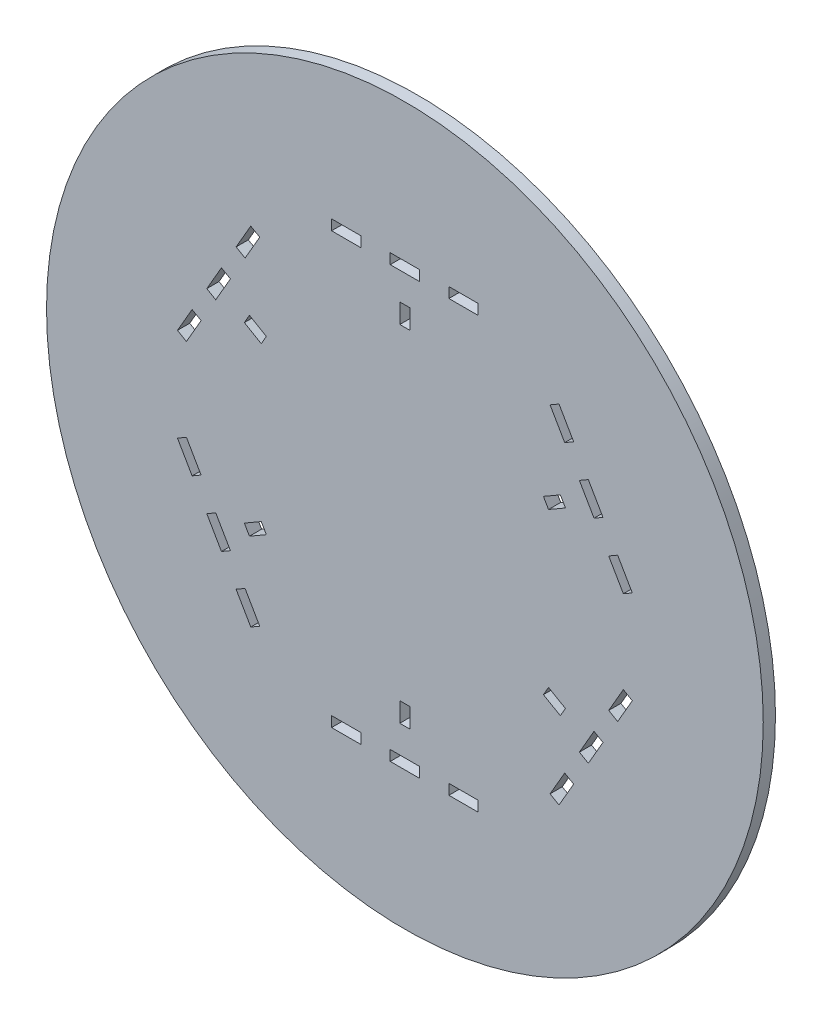
from build123d import *

# Parameters (mm, degrees)
SKETCH1_R           = 110
SKETCH1_W           = 9
SKETCH1_H           = 3.175
SKETCH1_W_2         = 3.125
SKETCH1_H_2         = 6
BOSS_EXTRUDE1_DEPTH = 1.875


with BuildPart() as part:
    # Sketch1 → Boss-Extrude1 (new, symmetric)
    with BuildSketch(Plane.XY):
        Circle(SKETCH1_R)
        with Locations((0, 66.025)):
            Rectangle(SKETCH1_W, SKETCH1_H, mode=Mode.SUBTRACT)
        with Locations((-18, 66.025)):
            Rectangle(SKETCH1_W, SKETCH1_H, mode=Mode.SUBTRACT)
        with Locations((18, 66.025)):
            Rectangle(SKETCH1_W, SKETCH1_H, mode=Mode.SUBTRACT)
        with Locations((0, 53)):
            Rectangle(SKETCH1_W_2, SKETCH1_H_2, mode=Mode.SUBTRACT)
        Polygon((60.804142613, 29.909135683), (56.304142613, 37.703364317), (53.554511956, 36.115864317), (58.054511956, 28.321635683), align=None, mode=Mode.SUBTRACT)
        Polygon((51.804142613, 45.497592951), (47.304142613, 53.291821585), (44.554511956, 51.704321585), (49.054511956, 43.910092951), align=None, mode=Mode.SUBTRACT)
        Polygon((69.804142613, 14.320678415), (67.054511956, 12.733178415), (62.554511956, 20.527407049), (65.304142613, 22.114907049), align=None, mode=Mode.SUBTRACT)
        Polygon((49.278672612, 26.646835307), (47.716172612, 29.353164693), (42.520020189, 26.353164693), (44.082520189, 23.646835307), align=None, mode=Mode.SUBTRACT)
        Polygon((56.304142613, -37.703364317), (60.804142613, -29.909135683), (58.054511956, -28.321635683), (53.554511956, -36.115864317), align=None, mode=Mode.SUBTRACT)
        Polygon((65.304142613, -22.114907049), (69.804142613, -14.320678415), (67.054511956, -12.733178415), (62.554511956, -20.527407049), align=None, mode=Mode.SUBTRACT)
        Polygon((47.304142613, -53.291821585), (44.554511956, -51.704321585), (49.054511956, -43.910092951), (51.804142613, -45.497592951), align=None, mode=Mode.SUBTRACT)
        Polygon((47.716172612, -29.353164693), (49.278672612, -26.646835307), (44.082520189, -23.646835307), (42.520020189, -26.353164693), align=None, mode=Mode.SUBTRACT)
        with Locations((0, -66.025)):
            Rectangle(SKETCH1_W, SKETCH1_H, mode=Mode.SUBTRACT)
        with Locations((18, -66.025)):
            Rectangle(SKETCH1_W, SKETCH1_H, mode=Mode.SUBTRACT)
        with Locations((-18, -66.025)):
            Rectangle(SKETCH1_W, SKETCH1_H, mode=Mode.SUBTRACT)
        with Locations((0, -53)):
            Rectangle(SKETCH1_W_2, SKETCH1_H_2, mode=Mode.SUBTRACT)
        Polygon((-60.804142613, -29.909135683), (-56.304142613, -37.703364317), (-53.554511956, -36.115864317), (-58.054511956, -28.321635683), align=None, mode=Mode.SUBTRACT)
        Polygon((-51.804142613, -45.497592951), (-47.304142613, -53.291821585), (-44.554511956, -51.704321585), (-49.054511956, -43.910092951), align=None, mode=Mode.SUBTRACT)
        Polygon((-69.804142613, -14.320678415), (-67.054511956, -12.733178415), (-62.554511956, -20.527407049), (-65.304142613, -22.114907049), align=None, mode=Mode.SUBTRACT)
        Polygon((-49.278672612, -26.646835307), (-47.716172612, -29.353164693), (-42.520020189, -26.353164693), (-44.082520189, -23.646835307), align=None, mode=Mode.SUBTRACT)
        Polygon((-56.304142613, 37.703364317), (-60.804142613, 29.909135683), (-58.054511956, 28.321635683), (-53.554511956, 36.115864317), align=None, mode=Mode.SUBTRACT)
        Polygon((-65.304142613, 22.114907049), (-69.804142613, 14.320678415), (-67.054511956, 12.733178415), (-62.554511956, 20.527407049), align=None, mode=Mode.SUBTRACT)
        Polygon((-47.304142613, 53.291821585), (-44.554511956, 51.704321585), (-49.054511956, 43.910092951), (-51.804142613, 45.497592951), align=None, mode=Mode.SUBTRACT)
        Polygon((-47.716172612, 29.353164693), (-49.278672612, 26.646835307), (-44.082520189, 23.646835307), (-42.520020189, 26.353164693), align=None, mode=Mode.SUBTRACT)
    extrude(amount=BOSS_EXTRUDE1_DEPTH, both=True)


solid = part.part
